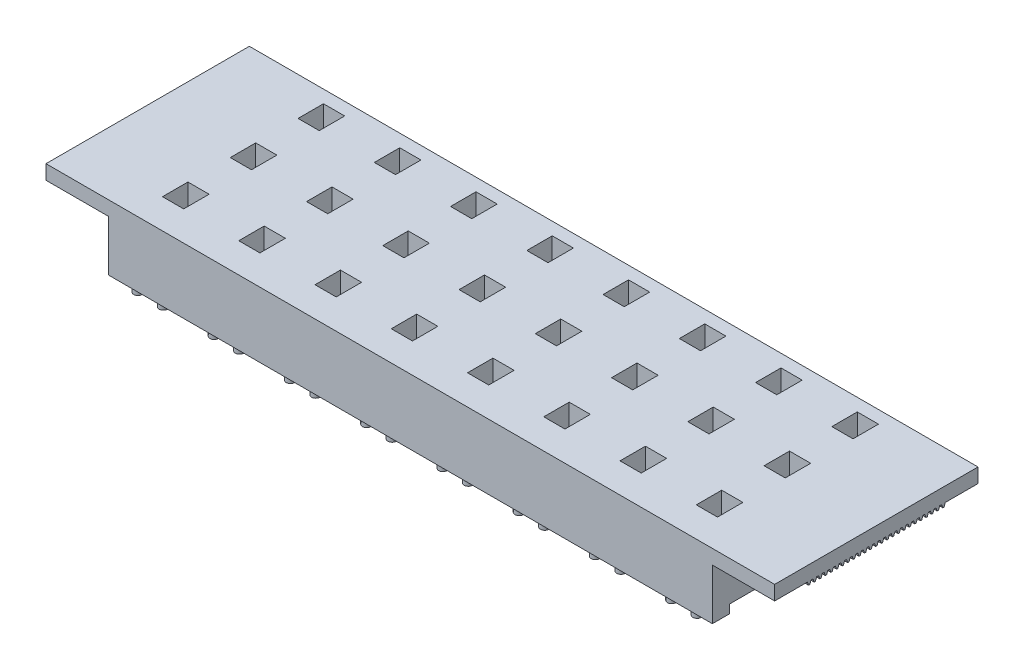
from build123d import *

# Parameters (mm, degrees)
SKETCH1_W                    = 86
SKETCH1_H                    = 24
BOSS_EXTRUDE1_DEPTH          = 6.7
SKETCH2_W                    = 7.35
SKETCH2_H                    = 5
CUT_EXTRUDE1_DEPTH           = 50.697987887
FIRST_RIDGE_DEPTH            = 78.65
RACK_LEFT_PATTERN_COUNT      = 13
RACK_LEFT_PATTERN_PITCH      = 0.66
RACK_LEFT_PATTERN_COL_COUNT  = 13
RACK_LEFT_PATTERN_COL_PITCH  = 0.66
MIRROR2_COPY_1_DEPTH         = 78.65
MIRROR2_COPY_2_DEPTH         = 78.65
MIRROR2_COPY_3_DEPTH         = 78.65
MIRROR2_COPY_4_DEPTH         = 78.65
MIRROR2_COPY_5_DEPTH         = 78.65
MIRROR2_COPY_6_DEPTH         = 78.65
MIRROR2_COPY_7_DEPTH         = 78.65
MIRROR2_COPY_8_DEPTH         = 78.65
MIRROR2_COPY_9_DEPTH         = 78.65
MIRROR2_COPY_10_DEPTH        = 78.65
MIRROR2_COPY_11_DEPTH        = 78.65
MIRROR2_COPY_12_DEPTH        = 78.65
MIRROR2_COPY_13_DEPTH        = 78.65
MIRROR2_COPY_14_DEPTH        = 78.65
MIRROR2_COPY_15_DEPTH        = 78.65
MIRROR2_COPY_16_DEPTH        = 78.65
MIRROR2_COPY_17_DEPTH        = 78.65
MIRROR2_COPY_18_DEPTH        = 78.65
MIRROR2_COPY_19_DEPTH        = 78.65
MIRROR2_COPY_20_DEPTH        = 78.65
MIRROR2_COPY_21_DEPTH        = 78.65
MIRROR2_COPY_22_DEPTH        = 78.65
MIRROR2_COPY_23_DEPTH        = 78.65
MIRROR2_COPY_24_DEPTH        = 78.65
SKETCH5_W                    = 2
SKETCH5_H                    = 1
BOSS_EXTRUDE2_DEPTH          = 71.3
SKETCH6_R                    = 0.5
BOSS_EXTRUDE3_DEPTH          = 1
LPATTERN1_COUNT              = 8
LPATTERN1_PITCH              = 9
LPATTERN2_COUNT              = 3
LPATTERN2_PITCH              = 8
LPATTERN2_COPY_1_SKETCH_R    = 0.5
LPATTERN2_COPY_1_DEPTH       = 1
LPATTERN2_COPY_2_SKETCH_R    = 0.5
LPATTERN2_COPY_2_DEPTH       = 1
LPATTERN2_COPY_3_SKETCH_R    = 0.5
LPATTERN2_COPY_3_DEPTH       = 1
LPATTERN2_COPY_4_SKETCH_R    = 0.5
LPATTERN2_COPY_4_DEPTH       = 1
LPATTERN2_COPY_5_SKETCH_R    = 0.5
LPATTERN2_COPY_5_DEPTH       = 1
LPATTERN2_COPY_6_SKETCH_R    = 0.5
LPATTERN2_COPY_6_DEPTH       = 1
LPATTERN2_COPY_7_SKETCH_R    = 0.5
LPATTERN2_COPY_7_DEPTH       = 1
LPATTERN2_COPY_8_SKETCH_R    = 0.5
LPATTERN2_COPY_8_DEPTH       = 1
LPATTERN2_COPY_9_SKETCH_R    = 0.5
LPATTERN2_COPY_9_DEPTH       = 1
LPATTERN2_COPY_10_SKETCH_R   = 0.5
LPATTERN2_COPY_10_DEPTH      = 1
LPATTERN2_COPY_11_SKETCH_R   = 0.5
LPATTERN2_COPY_11_DEPTH      = 1
LPATTERN2_COPY_12_SKETCH_R   = 0.5
LPATTERN2_COPY_12_DEPTH      = 1
LPATTERN2_COPY_13_SKETCH_R   = 0.5
LPATTERN2_COPY_13_DEPTH      = 1
LPATTERN2_COPY_14_SKETCH_R   = 0.5
LPATTERN2_COPY_14_DEPTH      = 1
SKETCH8_W                    = 4
SKETCH8_H                    = 4.5
SKETCH8_W_2                  = 2.5
SKETCH8_H_2                  = 3
BOSS_EXTRUDE4_DEPTH          = 2
SKETCH9_W                    = 2.5
SKETCH9_H                    = 3
CUT_EXTRUDE2_DEPTH           = 46.142995027
LPATTERN3_COUNT              = 4
LPATTERN3_PITCH              = 9
LPATTERN3_COL_COUNT          = 5
LPATTERN3_COL_PITCH          = 9
LPATTERN4_COUNT              = 3
LPATTERN4_PITCH              = 8
LPATTERN4_COPY_1_SKETCH_W    = 4
LPATTERN4_COPY_1_SKETCH_H    = 4.5
LPATTERN4_COPY_1_SKETCH_W_2  = 2.5
LPATTERN4_COPY_1_SKETCH_H_2  = 3
LPATTERN4_COPY_1_DEPTH       = 2
LPATTERN4_COPY_2_SKETCH_W    = 4
LPATTERN4_COPY_2_SKETCH_H    = 4.5
LPATTERN4_COPY_2_SKETCH_W_2  = 2.5
LPATTERN4_COPY_2_SKETCH_H_2  = 3
LPATTERN4_COPY_2_DEPTH       = 2
LPATTERN4_COPY_3_SKETCH_W    = 4
LPATTERN4_COPY_3_SKETCH_H    = 4.5
LPATTERN4_COPY_3_SKETCH_W_2  = 2.5
LPATTERN4_COPY_3_SKETCH_H_2  = 3
LPATTERN4_COPY_3_DEPTH       = 2
LPATTERN4_COPY_4_SKETCH_W    = 4
LPATTERN4_COPY_4_SKETCH_H    = 4.5
LPATTERN4_COPY_4_SKETCH_W_2  = 2.5
LPATTERN4_COPY_4_SKETCH_H_2  = 3
LPATTERN4_COPY_4_DEPTH       = 2
LPATTERN4_COPY_5_SKETCH_W    = 4
LPATTERN4_COPY_5_SKETCH_H    = 4.5
LPATTERN4_COPY_5_SKETCH_W_2  = 2.5
LPATTERN4_COPY_5_SKETCH_H_2  = 3
LPATTERN4_COPY_5_DEPTH       = 2
LPATTERN4_COPY_6_SKETCH_W    = 4
LPATTERN4_COPY_6_SKETCH_H    = 4.5
LPATTERN4_COPY_6_SKETCH_W_2  = 2.5
LPATTERN4_COPY_6_SKETCH_H_2  = 3
LPATTERN4_COPY_6_DEPTH       = 2
LPATTERN4_COPY_7_SKETCH_W    = 2.5
LPATTERN4_COPY_7_SKETCH_H    = 3
LPATTERN4_COPY_7_DEPTH       = 46.142995027
LPATTERN4_COPY_8_SKETCH_W    = 2.5
LPATTERN4_COPY_8_SKETCH_H    = 3
LPATTERN4_COPY_8_DEPTH       = 46.142995027
LPATTERN4_COPY_9_SKETCH_W    = 2.5
LPATTERN4_COPY_9_SKETCH_H    = 3
LPATTERN4_COPY_9_DEPTH       = 46.142995027
LPATTERN4_COPY_10_SKETCH_W   = 2.5
LPATTERN4_COPY_10_SKETCH_H   = 3
LPATTERN4_COPY_10_DEPTH      = 46.142995027
LPATTERN4_COPY_11_SKETCH_W   = 2.5
LPATTERN4_COPY_11_SKETCH_H   = 3
LPATTERN4_COPY_11_DEPTH      = 46.142995027
LPATTERN4_COPY_12_SKETCH_W   = 2.5
LPATTERN4_COPY_12_SKETCH_H   = 3
LPATTERN4_COPY_12_DEPTH      = 46.142995027
LPATTERN4_COPY_13_SKETCH_W   = 4
LPATTERN4_COPY_13_SKETCH_H   = 4.5
LPATTERN4_COPY_13_SKETCH_W_2 = 2.5
LPATTERN4_COPY_13_SKETCH_H_2 = 3
LPATTERN4_COPY_13_DEPTH      = 2
LPATTERN4_COPY_14_SKETCH_W   = 4
LPATTERN4_COPY_14_SKETCH_H   = 4.5
LPATTERN4_COPY_14_SKETCH_W_2 = 2.5
LPATTERN4_COPY_14_SKETCH_H_2 = 3
LPATTERN4_COPY_14_DEPTH      = 2
LPATTERN4_COPY_15_SKETCH_W   = 4
LPATTERN4_COPY_15_SKETCH_H   = 4.5
LPATTERN4_COPY_15_SKETCH_W_2 = 2.5
LPATTERN4_COPY_15_SKETCH_H_2 = 3
LPATTERN4_COPY_15_DEPTH      = 2
LPATTERN4_COPY_16_SKETCH_W   = 4
LPATTERN4_COPY_16_SKETCH_H   = 4.5
LPATTERN4_COPY_16_SKETCH_W_2 = 2.5
LPATTERN4_COPY_16_SKETCH_H_2 = 3
LPATTERN4_COPY_16_DEPTH      = 2
LPATTERN4_COPY_17_SKETCH_W   = 4
LPATTERN4_COPY_17_SKETCH_H   = 4.5
LPATTERN4_COPY_17_SKETCH_W_2 = 2.5
LPATTERN4_COPY_17_SKETCH_H_2 = 3
LPATTERN4_COPY_17_DEPTH      = 2
LPATTERN4_COPY_18_SKETCH_W   = 4
LPATTERN4_COPY_18_SKETCH_H   = 4.5
LPATTERN4_COPY_18_SKETCH_W_2 = 2.5
LPATTERN4_COPY_18_SKETCH_H_2 = 3
LPATTERN4_COPY_18_DEPTH      = 2
LPATTERN4_COPY_19_SKETCH_W   = 4
LPATTERN4_COPY_19_SKETCH_H   = 4.5
LPATTERN4_COPY_19_SKETCH_W_2 = 2.5
LPATTERN4_COPY_19_SKETCH_H_2 = 3
LPATTERN4_COPY_19_DEPTH      = 2
LPATTERN4_COPY_20_SKETCH_W   = 4
LPATTERN4_COPY_20_SKETCH_H   = 4.5
LPATTERN4_COPY_20_SKETCH_W_2 = 2.5
LPATTERN4_COPY_20_SKETCH_H_2 = 3
LPATTERN4_COPY_20_DEPTH      = 2
LPATTERN4_COPY_21_SKETCH_W   = 2.5
LPATTERN4_COPY_21_SKETCH_H   = 3
LPATTERN4_COPY_21_DEPTH      = 46.142995027
LPATTERN4_COPY_22_SKETCH_W   = 2.5
LPATTERN4_COPY_22_SKETCH_H   = 3
LPATTERN4_COPY_22_DEPTH      = 46.142995027
LPATTERN4_COPY_23_SKETCH_W   = 2.5
LPATTERN4_COPY_23_SKETCH_H   = 3
LPATTERN4_COPY_23_DEPTH      = 46.142995027
LPATTERN4_COPY_24_SKETCH_W   = 2.5
LPATTERN4_COPY_24_SKETCH_H   = 3
LPATTERN4_COPY_24_DEPTH      = 46.142995027
LPATTERN4_COPY_25_SKETCH_W   = 2.5
LPATTERN4_COPY_25_SKETCH_H   = 3
LPATTERN4_COPY_25_DEPTH      = 46.142995027
LPATTERN4_COPY_26_SKETCH_W   = 2.5
LPATTERN4_COPY_26_SKETCH_H   = 3
LPATTERN4_COPY_26_DEPTH      = 46.142995027
LPATTERN4_COPY_27_SKETCH_W   = 2.5
LPATTERN4_COPY_27_SKETCH_H   = 3
LPATTERN4_COPY_27_DEPTH      = 46.142995027
LPATTERN4_COPY_28_SKETCH_W   = 2.5
LPATTERN4_COPY_28_SKETCH_H   = 3
LPATTERN4_COPY_28_DEPTH      = 46.142995027
LPATTERN4_COPY_29_SKETCH_W   = 2.5
LPATTERN4_COPY_29_SKETCH_H   = 3
LPATTERN4_COPY_29_DEPTH      = 46.142995027
LPATTERN4_COPY_30_SKETCH_W   = 2.5
LPATTERN4_COPY_30_SKETCH_H   = 3
LPATTERN4_COPY_30_DEPTH      = 46.142995027


with BuildPart() as part:
    # Sketch1 → Boss-Extrude1 (new body)
    with BuildSketch(Plane(origin=(0, 0, 0), x_dir=(1, 0, 0), z_dir=(0, 1, 0))):
        Rectangle(SKETCH1_W, SKETCH1_H)
    extrude(amount=BOSS_EXTRUDE1_DEPTH)

    # Sketch2 → Cut-Extrude1 (cut, through all)
    with BuildSketch(Plane.XY.offset(12)):
        with Locations((39.325, 2.5)):
            Rectangle(SKETCH2_W, SKETCH2_H)
    cut_extrude1 = extrude(amount=-CUT_EXTRUDE1_DEPTH, mode=Mode.SUBTRACT)

    # Mirror1: Cut-Extrude1 across plane
    add(cut_extrude1.mirror(Plane(origin=(0, 0, 0), x_dir=(0, 0, 1), z_dir=(1, 0, 0))), mode=Mode.SUBTRACT)

    # Sketch4 → First Ridge (add)
    with BuildSketch(Plane(origin=(43, 0, 0), x_dir=(0, 0, -1), z_dir=(1, 0, 0))):
        Polygon((0.220588094, 5), (-0.220588094, 5), (-0.075, 4.6), (0.075, 4.6), align=None)
    first_ridge = extrude(amount=-FIRST_RIDGE_DEPTH)

    # Rack Left Pattern: First Ridge ×13
    with Locations(*[(0, 0, i * RACK_LEFT_PATTERN_PITCH) for i in range(1, RACK_LEFT_PATTERN_COUNT)]):
        add(first_ridge)

    # Rack Left Pattern col: First Ridge ×13
    with Locations(*[(0, 0, -i * RACK_LEFT_PATTERN_COL_PITCH) for i in range(1, RACK_LEFT_PATTERN_COL_COUNT)]):
        add(first_ridge)

    # Mirror2: First Ridge across plane
    add(first_ridge.mirror(Plane(origin=(0, 0, 0), x_dir=(0, 0, 1), z_dir=(1, 0, 0))))

    # Mirror2 copy 1 sketch → Mirror2 copy 1 (add)
    with BuildSketch(Plane(origin=(-43, 0, 0.66), x_dir=(0, 0, -1), z_dir=(-1, 0, 0))):
        Polygon((0.220588094, -5), (-0.220588094, -5), (-0.075, -4.6), (0.075, -4.6), align=None)
    extrude(amount=-MIRROR2_COPY_1_DEPTH)

    # Mirror2 copy 2 sketch → Mirror2 copy 2 (add)
    with BuildSketch(Plane(origin=(-43, 0, 1.32), x_dir=(0, 0, -1), z_dir=(-1, 0, 0))):
        Polygon((0.220588094, -5), (-0.220588094, -5), (-0.075, -4.6), (0.075, -4.6), align=None)
    extrude(amount=-MIRROR2_COPY_2_DEPTH)

    # Mirror2 copy 3 sketch → Mirror2 copy 3 (add)
    with BuildSketch(Plane(origin=(-43, 0, 1.98), x_dir=(0, 0, -1), z_dir=(-1, 0, 0))):
        Polygon((0.220588094, -5), (-0.220588094, -5), (-0.075, -4.6), (0.075, -4.6), align=None)
    extrude(amount=-MIRROR2_COPY_3_DEPTH)

    # Mirror2 copy 4 sketch → Mirror2 copy 4 (add)
    with BuildSketch(Plane(origin=(-43, 0, 2.64), x_dir=(0, 0, -1), z_dir=(-1, 0, 0))):
        Polygon((0.220588094, -5), (-0.220588094, -5), (-0.075, -4.6), (0.075, -4.6), align=None)
    extrude(amount=-MIRROR2_COPY_4_DEPTH)

    # Mirror2 copy 5 sketch → Mirror2 copy 5 (add)
    with BuildSketch(Plane(origin=(-43, 0, 3.3), x_dir=(0, 0, -1), z_dir=(-1, 0, 0))):
        Polygon((0.220588094, -5), (-0.220588094, -5), (-0.075, -4.6), (0.075, -4.6), align=None)
    extrude(amount=-MIRROR2_COPY_5_DEPTH)

    # Mirror2 copy 6 sketch → Mirror2 copy 6 (add)
    with BuildSketch(Plane(origin=(-43, 0, 3.96), x_dir=(0, 0, -1), z_dir=(-1, 0, 0))):
        Polygon((0.220588094, -5), (-0.220588094, -5), (-0.075, -4.6), (0.075, -4.6), align=None)
    extrude(amount=-MIRROR2_COPY_6_DEPTH)

    # Mirror2 copy 7 sketch → Mirror2 copy 7 (add)
    with BuildSketch(Plane(origin=(-43, 0, 4.62), x_dir=(0, 0, -1), z_dir=(-1, 0, 0))):
        Polygon((0.220588094, -5), (-0.220588094, -5), (-0.075, -4.6), (0.075, -4.6), align=None)
    extrude(amount=-MIRROR2_COPY_7_DEPTH)

    # Mirror2 copy 8 sketch → Mirror2 copy 8 (add)
    with BuildSketch(Plane(origin=(-43, 0, 5.28), x_dir=(0, 0, -1), z_dir=(-1, 0, 0))):
        Polygon((0.220588094, -5), (-0.220588094, -5), (-0.075, -4.6), (0.075, -4.6), align=None)
    extrude(amount=-MIRROR2_COPY_8_DEPTH)

    # Mirror2 copy 9 sketch → Mirror2 copy 9 (add)
    with BuildSketch(Plane(origin=(-43, 0, 5.94), x_dir=(0, 0, -1), z_dir=(-1, 0, 0))):
        Polygon((0.220588094, -5), (-0.220588094, -5), (-0.075, -4.6), (0.075, -4.6), align=None)
    extrude(amount=-MIRROR2_COPY_9_DEPTH)

    # Mirror2 copy 10 sketch → Mirror2 copy 10 (add)
    with BuildSketch(Plane(origin=(-43, 0, 6.6), x_dir=(0, 0, -1), z_dir=(-1, 0, 0))):
        Polygon((0.220588094, -5), (-0.220588094, -5), (-0.075, -4.6), (0.075, -4.6), align=None)
    extrude(amount=-MIRROR2_COPY_10_DEPTH)

    # Mirror2 copy 11 sketch → Mirror2 copy 11 (add)
    with BuildSketch(Plane(origin=(-43, 0, 7.26), x_dir=(0, 0, -1), z_dir=(-1, 0, 0))):
        Polygon((0.220588094, -5), (-0.220588094, -5), (-0.075, -4.6), (0.075, -4.6), align=None)
    extrude(amount=-MIRROR2_COPY_11_DEPTH)

    # Mirror2 copy 12 sketch → Mirror2 copy 12 (add)
    with BuildSketch(Plane(origin=(-43, 0, 7.92), x_dir=(0, 0, -1), z_dir=(-1, 0, 0))):
        Polygon((0.220588094, -5), (-0.220588094, -5), (-0.075, -4.6), (0.075, -4.6), align=None)
    extrude(amount=-MIRROR2_COPY_12_DEPTH)

    # Mirror2 copy 13 sketch → Mirror2 copy 13 (add)
    with BuildSketch(Plane(origin=(-43, 0, -0.66), x_dir=(0, 0, -1), z_dir=(-1, 0, 0))):
        Polygon((0.220588094, -5), (-0.220588094, -5), (-0.075, -4.6), (0.075, -4.6), align=None)
    extrude(amount=-MIRROR2_COPY_13_DEPTH)

    # Mirror2 copy 14 sketch → Mirror2 copy 14 (add)
    with BuildSketch(Plane(origin=(-43, 0, -1.32), x_dir=(0, 0, -1), z_dir=(-1, 0, 0))):
        Polygon((0.220588094, -5), (-0.220588094, -5), (-0.075, -4.6), (0.075, -4.6), align=None)
    extrude(amount=-MIRROR2_COPY_14_DEPTH)

    # Mirror2 copy 15 sketch → Mirror2 copy 15 (add)
    with BuildSketch(Plane(origin=(-43, 0, -1.98), x_dir=(0, 0, -1), z_dir=(-1, 0, 0))):
        Polygon((0.220588094, -5), (-0.220588094, -5), (-0.075, -4.6), (0.075, -4.6), align=None)
    extrude(amount=-MIRROR2_COPY_15_DEPTH)

    # Mirror2 copy 16 sketch → Mirror2 copy 16 (add)
    with BuildSketch(Plane(origin=(-43, 0, -2.64), x_dir=(0, 0, -1), z_dir=(-1, 0, 0))):
        Polygon((0.220588094, -5), (-0.220588094, -5), (-0.075, -4.6), (0.075, -4.6), align=None)
    extrude(amount=-MIRROR2_COPY_16_DEPTH)

    # Mirror2 copy 17 sketch → Mirror2 copy 17 (add)
    with BuildSketch(Plane(origin=(-43, 0, -3.3), x_dir=(0, 0, -1), z_dir=(-1, 0, 0))):
        Polygon((0.220588094, -5), (-0.220588094, -5), (-0.075, -4.6), (0.075, -4.6), align=None)
    extrude(amount=-MIRROR2_COPY_17_DEPTH)

    # Mirror2 copy 18 sketch → Mirror2 copy 18 (add)
    with BuildSketch(Plane(origin=(-43, 0, -3.96), x_dir=(0, 0, -1), z_dir=(-1, 0, 0))):
        Polygon((0.220588094, -5), (-0.220588094, -5), (-0.075, -4.6), (0.075, -4.6), align=None)
    extrude(amount=-MIRROR2_COPY_18_DEPTH)

    # Mirror2 copy 19 sketch → Mirror2 copy 19 (add)
    with BuildSketch(Plane(origin=(-43, 0, -4.62), x_dir=(0, 0, -1), z_dir=(-1, 0, 0))):
        Polygon((0.220588094, -5), (-0.220588094, -5), (-0.075, -4.6), (0.075, -4.6), align=None)
    extrude(amount=-MIRROR2_COPY_19_DEPTH)

    # Mirror2 copy 20 sketch → Mirror2 copy 20 (add)
    with BuildSketch(Plane(origin=(-43, 0, -5.28), x_dir=(0, 0, -1), z_dir=(-1, 0, 0))):
        Polygon((0.220588094, -5), (-0.220588094, -5), (-0.075, -4.6), (0.075, -4.6), align=None)
    extrude(amount=-MIRROR2_COPY_20_DEPTH)

    # Mirror2 copy 21 sketch → Mirror2 copy 21 (add)
    with BuildSketch(Plane(origin=(-43, 0, -5.94), x_dir=(0, 0, -1), z_dir=(-1, 0, 0))):
        Polygon((0.220588094, -5), (-0.220588094, -5), (-0.075, -4.6), (0.075, -4.6), align=None)
    extrude(amount=-MIRROR2_COPY_21_DEPTH)

    # Mirror2 copy 22 sketch → Mirror2 copy 22 (add)
    with BuildSketch(Plane(origin=(-43, 0, -6.6), x_dir=(0, 0, -1), z_dir=(-1, 0, 0))):
        Polygon((0.220588094, -5), (-0.220588094, -5), (-0.075, -4.6), (0.075, -4.6), align=None)
    extrude(amount=-MIRROR2_COPY_22_DEPTH)

    # Mirror2 copy 23 sketch → Mirror2 copy 23 (add)
    with BuildSketch(Plane(origin=(-43, 0, -7.26), x_dir=(0, 0, -1), z_dir=(-1, 0, 0))):
        Polygon((0.220588094, -5), (-0.220588094, -5), (-0.075, -4.6), (0.075, -4.6), align=None)
    extrude(amount=-MIRROR2_COPY_23_DEPTH)

    # Mirror2 copy 24 sketch → Mirror2 copy 24 (add)
    with BuildSketch(Plane(origin=(-43, 0, -7.92), x_dir=(0, 0, -1), z_dir=(-1, 0, 0))):
        Polygon((0.220588094, -5), (-0.220588094, -5), (-0.075, -4.6), (0.075, -4.6), align=None)
    extrude(amount=-MIRROR2_COPY_24_DEPTH)

    # Sketch5 → Boss-Extrude2 (add)
    with BuildSketch(Plane.ZY.offset(35.65)):
        with Locations((-5, -0.5)):
            Rectangle(SKETCH5_W, SKETCH5_H)
        with Locations((3, -0.5)):
            Rectangle(SKETCH5_W, SKETCH5_H)
        with Locations((11, -0.5)):
            Rectangle(SKETCH5_W, SKETCH5_H)
    extrude(amount=-BOSS_EXTRUDE2_DEPTH)

    # Sketch6 → Boss-Extrude3 (add)
    with BuildSketch(Plane.XZ.offset(1)):
        with Locations(Location((-33.15, -5, 0), (0, 0, 270))):
            Circle(SKETCH6_R)
        with Locations(Location((-30.15, -5, 0), (0, 0, 270))):
            Circle(SKETCH6_R)
    boss_extrude3 = extrude(amount=BOSS_EXTRUDE3_DEPTH)

    # LPattern1: Boss-Extrude3 ×8
    with Locations(*[(i * LPATTERN1_PITCH, 0, 0) for i in range(1, LPATTERN1_COUNT)]):
        add(boss_extrude3)

    # LPattern2: Boss-Extrude3 ×3
    with Locations(*[(0, 0, i * LPATTERN2_PITCH) for i in range(1, LPATTERN2_COUNT)]):
        add(boss_extrude3)

    # LPattern2 copy 1 sketch → LPattern2 copy 1 (add)
    with BuildSketch(Plane(origin=(9, -1, 8), x_dir=(1, 0, 0), z_dir=(0, -1, 0))):
        with Locations(Location((-33.15, -5, 0), (0, 0, 270))):
            Circle(LPATTERN2_COPY_1_SKETCH_R)
        with Locations(Location((-30.15, -5, 0), (0, 0, 270))):
            Circle(LPATTERN2_COPY_1_SKETCH_R)
    extrude(amount=LPATTERN2_COPY_1_DEPTH)

    # LPattern2 copy 2 sketch → LPattern2 copy 2 (add)
    with BuildSketch(Plane(origin=(9, -1, 16), x_dir=(1, 0, 0), z_dir=(0, -1, 0))):
        with Locations(Location((-33.15, -5, 0), (0, 0, 270))):
            Circle(LPATTERN2_COPY_2_SKETCH_R)
        with Locations(Location((-30.15, -5, 0), (0, 0, 270))):
            Circle(LPATTERN2_COPY_2_SKETCH_R)
    extrude(amount=LPATTERN2_COPY_2_DEPTH)

    # LPattern2 copy 3 sketch → LPattern2 copy 3 (add)
    with BuildSketch(Plane(origin=(18, -1, 8), x_dir=(1, 0, 0), z_dir=(0, -1, 0))):
        with Locations(Location((-33.15, -5, 0), (0, 0, 270))):
            Circle(LPATTERN2_COPY_3_SKETCH_R)
        with Locations(Location((-30.15, -5, 0), (0, 0, 270))):
            Circle(LPATTERN2_COPY_3_SKETCH_R)
    extrude(amount=LPATTERN2_COPY_3_DEPTH)

    # LPattern2 copy 4 sketch → LPattern2 copy 4 (add)
    with BuildSketch(Plane(origin=(18, -1, 16), x_dir=(1, 0, 0), z_dir=(0, -1, 0))):
        with Locations(Location((-33.15, -5, 0), (0, 0, 270))):
            Circle(LPATTERN2_COPY_4_SKETCH_R)
        with Locations(Location((-30.15, -5, 0), (0, 0, 270))):
            Circle(LPATTERN2_COPY_4_SKETCH_R)
    extrude(amount=LPATTERN2_COPY_4_DEPTH)

    # LPattern2 copy 5 sketch → LPattern2 copy 5 (add)
    with BuildSketch(Plane(origin=(27, -1, 8), x_dir=(1, 0, 0), z_dir=(0, -1, 0))):
        with Locations(Location((-33.15, -5, 0), (0, 0, 270))):
            Circle(LPATTERN2_COPY_5_SKETCH_R)
        with Locations(Location((-30.15, -5, 0), (0, 0, 270))):
            Circle(LPATTERN2_COPY_5_SKETCH_R)
    extrude(amount=LPATTERN2_COPY_5_DEPTH)

    # LPattern2 copy 6 sketch → LPattern2 copy 6 (add)
    with BuildSketch(Plane(origin=(27, -1, 16), x_dir=(1, 0, 0), z_dir=(0, -1, 0))):
        with Locations(Location((-33.15, -5, 0), (0, 0, 270))):
            Circle(LPATTERN2_COPY_6_SKETCH_R)
        with Locations(Location((-30.15, -5, 0), (0, 0, 270))):
            Circle(LPATTERN2_COPY_6_SKETCH_R)
    extrude(amount=LPATTERN2_COPY_6_DEPTH)

    # LPattern2 copy 7 sketch → LPattern2 copy 7 (add)
    with BuildSketch(Plane(origin=(36, -1, 8), x_dir=(1, 0, 0), z_dir=(0, -1, 0))):
        with Locations(Location((-33.15, -5, 0), (0, 0, 270))):
            Circle(LPATTERN2_COPY_7_SKETCH_R)
        with Locations(Location((-30.15, -5, 0), (0, 0, 270))):
            Circle(LPATTERN2_COPY_7_SKETCH_R)
    extrude(amount=LPATTERN2_COPY_7_DEPTH)

    # LPattern2 copy 8 sketch → LPattern2 copy 8 (add)
    with BuildSketch(Plane(origin=(36, -1, 16), x_dir=(1, 0, 0), z_dir=(0, -1, 0))):
        with Locations(Location((-33.15, -5, 0), (0, 0, 270))):
            Circle(LPATTERN2_COPY_8_SKETCH_R)
        with Locations(Location((-30.15, -5, 0), (0, 0, 270))):
            Circle(LPATTERN2_COPY_8_SKETCH_R)
    extrude(amount=LPATTERN2_COPY_8_DEPTH)

    # LPattern2 copy 9 sketch → LPattern2 copy 9 (add)
    with BuildSketch(Plane(origin=(45, -1, 8), x_dir=(1, 0, 0), z_dir=(0, -1, 0))):
        with Locations(Location((-33.15, -5, 0), (0, 0, 270))):
            Circle(LPATTERN2_COPY_9_SKETCH_R)
        with Locations(Location((-30.15, -5, 0), (0, 0, 270))):
            Circle(LPATTERN2_COPY_9_SKETCH_R)
    extrude(amount=LPATTERN2_COPY_9_DEPTH)

    # LPattern2 copy 10 sketch → LPattern2 copy 10 (add)
    with BuildSketch(Plane(origin=(45, -1, 16), x_dir=(1, 0, 0), z_dir=(0, -1, 0))):
        with Locations(Location((-33.15, -5, 0), (0, 0, 270))):
            Circle(LPATTERN2_COPY_10_SKETCH_R)
        with Locations(Location((-30.15, -5, 0), (0, 0, 270))):
            Circle(LPATTERN2_COPY_10_SKETCH_R)
    extrude(amount=LPATTERN2_COPY_10_DEPTH)

    # LPattern2 copy 11 sketch → LPattern2 copy 11 (add)
    with BuildSketch(Plane(origin=(54, -1, 8), x_dir=(1, 0, 0), z_dir=(0, -1, 0))):
        with Locations(Location((-33.15, -5, 0), (0, 0, 270))):
            Circle(LPATTERN2_COPY_11_SKETCH_R)
        with Locations(Location((-30.15, -5, 0), (0, 0, 270))):
            Circle(LPATTERN2_COPY_11_SKETCH_R)
    extrude(amount=LPATTERN2_COPY_11_DEPTH)

    # LPattern2 copy 12 sketch → LPattern2 copy 12 (add)
    with BuildSketch(Plane(origin=(54, -1, 16), x_dir=(1, 0, 0), z_dir=(0, -1, 0))):
        with Locations(Location((-33.15, -5, 0), (0, 0, 270))):
            Circle(LPATTERN2_COPY_12_SKETCH_R)
        with Locations(Location((-30.15, -5, 0), (0, 0, 270))):
            Circle(LPATTERN2_COPY_12_SKETCH_R)
    extrude(amount=LPATTERN2_COPY_12_DEPTH)

    # LPattern2 copy 13 sketch → LPattern2 copy 13 (add)
    with BuildSketch(Plane(origin=(63, -1, 8), x_dir=(1, 0, 0), z_dir=(0, -1, 0))):
        with Locations(Location((-33.15, -5, 0), (0, 0, 270))):
            Circle(LPATTERN2_COPY_13_SKETCH_R)
        with Locations(Location((-30.15, -5, 0), (0, 0, 270))):
            Circle(LPATTERN2_COPY_13_SKETCH_R)
    extrude(amount=LPATTERN2_COPY_13_DEPTH)

    # LPattern2 copy 14 sketch → LPattern2 copy 14 (add)
    with BuildSketch(Plane(origin=(63, -1, 16), x_dir=(1, 0, 0), z_dir=(0, -1, 0))):
        with Locations(Location((-33.15, -5, 0), (0, 0, 270))):
            Circle(LPATTERN2_COPY_14_SKETCH_R)
        with Locations(Location((-30.15, -5, 0), (0, 0, 270))):
            Circle(LPATTERN2_COPY_14_SKETCH_R)
    extrude(amount=LPATTERN2_COPY_14_DEPTH)

    # Sketch8 → Boss-Extrude4 (add)
    with BuildSketch(Plane.XZ):
        with Locations((-4.5, 7)):
            Rectangle(SKETCH8_W, SKETCH8_H)
        with Locations((-4.5, 7)):
            Rectangle(SKETCH8_W_2, SKETCH8_H_2, mode=Mode.SUBTRACT)
    boss_extrude4 = extrude(amount=BOSS_EXTRUDE4_DEPTH)

    # Sketch9 → Cut-Extrude2 (cut, through all)
    with BuildSketch(Plane.XZ):
        with Locations((-4.5, 7)):
            Rectangle(SKETCH9_W, SKETCH9_H)
    cut_extrude2 = extrude(amount=-CUT_EXTRUDE2_DEPTH, mode=Mode.SUBTRACT)

    # LPattern3: Boss-Extrude4, Cut-Extrude2 ×4
    with Locations(*[(-i * LPATTERN3_PITCH, 0, 0) for i in range(1, LPATTERN3_COUNT)]):
        add(boss_extrude4)
        add(cut_extrude2, mode=Mode.SUBTRACT)

    # LPattern3 col: Boss-Extrude4, Cut-Extrude2 ×5
    with Locations(*[(i * LPATTERN3_COL_PITCH, 0, 0) for i in range(1, LPATTERN3_COL_COUNT)]):
        add(boss_extrude4)
        add(cut_extrude2, mode=Mode.SUBTRACT)

    # LPattern4: Boss-Extrude4 ×3
    with Locations(*[(0, 0, -i * LPATTERN4_PITCH) for i in range(1, LPATTERN4_COUNT)]):
        add(boss_extrude4)

    # LPattern4 copy 1 sketch → LPattern4 copy 1 (add)
    with BuildSketch(Plane(origin=(-9, 0, -8), x_dir=(1, 0, 0), z_dir=(0, -1, 0))):
        with Locations((-4.5, 7)):
            Rectangle(LPATTERN4_COPY_1_SKETCH_W, LPATTERN4_COPY_1_SKETCH_H)
        with Locations((-4.5, 7)):
            Rectangle(LPATTERN4_COPY_1_SKETCH_W_2, LPATTERN4_COPY_1_SKETCH_H_2, mode=Mode.SUBTRACT)
    extrude(amount=LPATTERN4_COPY_1_DEPTH)

    # LPattern4 copy 2 sketch → LPattern4 copy 2 (add)
    with BuildSketch(Plane(origin=(-9, 0, -16), x_dir=(1, 0, 0), z_dir=(0, -1, 0))):
        with Locations((-4.5, 7)):
            Rectangle(LPATTERN4_COPY_2_SKETCH_W, LPATTERN4_COPY_2_SKETCH_H)
        with Locations((-4.5, 7)):
            Rectangle(LPATTERN4_COPY_2_SKETCH_W_2, LPATTERN4_COPY_2_SKETCH_H_2, mode=Mode.SUBTRACT)
    extrude(amount=LPATTERN4_COPY_2_DEPTH)

    # LPattern4 copy 3 sketch → LPattern4 copy 3 (add)
    with BuildSketch(Plane(origin=(-18, 0, -8), x_dir=(1, 0, 0), z_dir=(0, -1, 0))):
        with Locations((-4.5, 7)):
            Rectangle(LPATTERN4_COPY_3_SKETCH_W, LPATTERN4_COPY_3_SKETCH_H)
        with Locations((-4.5, 7)):
            Rectangle(LPATTERN4_COPY_3_SKETCH_W_2, LPATTERN4_COPY_3_SKETCH_H_2, mode=Mode.SUBTRACT)
    extrude(amount=LPATTERN4_COPY_3_DEPTH)

    # LPattern4 copy 4 sketch → LPattern4 copy 4 (add)
    with BuildSketch(Plane(origin=(-18, 0, -16), x_dir=(1, 0, 0), z_dir=(0, -1, 0))):
        with Locations((-4.5, 7)):
            Rectangle(LPATTERN4_COPY_4_SKETCH_W, LPATTERN4_COPY_4_SKETCH_H)
        with Locations((-4.5, 7)):
            Rectangle(LPATTERN4_COPY_4_SKETCH_W_2, LPATTERN4_COPY_4_SKETCH_H_2, mode=Mode.SUBTRACT)
    extrude(amount=LPATTERN4_COPY_4_DEPTH)

    # LPattern4 copy 5 sketch → LPattern4 copy 5 (add)
    with BuildSketch(Plane(origin=(-27, 0, -8), x_dir=(1, 0, 0), z_dir=(0, -1, 0))):
        with Locations((-4.5, 7)):
            Rectangle(LPATTERN4_COPY_5_SKETCH_W, LPATTERN4_COPY_5_SKETCH_H)
        with Locations((-4.5, 7)):
            Rectangle(LPATTERN4_COPY_5_SKETCH_W_2, LPATTERN4_COPY_5_SKETCH_H_2, mode=Mode.SUBTRACT)
    extrude(amount=LPATTERN4_COPY_5_DEPTH)

    # LPattern4 copy 6 sketch → LPattern4 copy 6 (add)
    with BuildSketch(Plane(origin=(-27, 0, -16), x_dir=(1, 0, 0), z_dir=(0, -1, 0))):
        with Locations((-4.5, 7)):
            Rectangle(LPATTERN4_COPY_6_SKETCH_W, LPATTERN4_COPY_6_SKETCH_H)
        with Locations((-4.5, 7)):
            Rectangle(LPATTERN4_COPY_6_SKETCH_W_2, LPATTERN4_COPY_6_SKETCH_H_2, mode=Mode.SUBTRACT)
    extrude(amount=LPATTERN4_COPY_6_DEPTH)

    # LPattern4 copy 7 sketch → LPattern4 copy 7 (cut, through all)
    with BuildSketch(Plane(origin=(-9, 0, -8), x_dir=(1, 0, 0), z_dir=(0, -1, 0))):
        with Locations((-4.5, 7)):
            Rectangle(LPATTERN4_COPY_7_SKETCH_W, LPATTERN4_COPY_7_SKETCH_H)
    extrude(amount=-LPATTERN4_COPY_7_DEPTH, mode=Mode.SUBTRACT)

    # LPattern4 copy 8 sketch → LPattern4 copy 8 (cut, through all)
    with BuildSketch(Plane(origin=(-9, 0, -16), x_dir=(1, 0, 0), z_dir=(0, -1, 0))):
        with Locations((-4.5, 7)):
            Rectangle(LPATTERN4_COPY_8_SKETCH_W, LPATTERN4_COPY_8_SKETCH_H)
    extrude(amount=-LPATTERN4_COPY_8_DEPTH, mode=Mode.SUBTRACT)

    # LPattern4 copy 9 sketch → LPattern4 copy 9 (cut, through all)
    with BuildSketch(Plane(origin=(-18, 0, -8), x_dir=(1, 0, 0), z_dir=(0, -1, 0))):
        with Locations((-4.5, 7)):
            Rectangle(LPATTERN4_COPY_9_SKETCH_W, LPATTERN4_COPY_9_SKETCH_H)
    extrude(amount=-LPATTERN4_COPY_9_DEPTH, mode=Mode.SUBTRACT)

    # LPattern4 copy 10 sketch → LPattern4 copy 10 (cut, through all)
    with BuildSketch(Plane(origin=(-18, 0, -16), x_dir=(1, 0, 0), z_dir=(0, -1, 0))):
        with Locations((-4.5, 7)):
            Rectangle(LPATTERN4_COPY_10_SKETCH_W, LPATTERN4_COPY_10_SKETCH_H)
    extrude(amount=-LPATTERN4_COPY_10_DEPTH, mode=Mode.SUBTRACT)

    # LPattern4 copy 11 sketch → LPattern4 copy 11 (cut, through all)
    with BuildSketch(Plane(origin=(-27, 0, -8), x_dir=(1, 0, 0), z_dir=(0, -1, 0))):
        with Locations((-4.5, 7)):
            Rectangle(LPATTERN4_COPY_11_SKETCH_W, LPATTERN4_COPY_11_SKETCH_H)
    extrude(amount=-LPATTERN4_COPY_11_DEPTH, mode=Mode.SUBTRACT)

    # LPattern4 copy 12 sketch → LPattern4 copy 12 (cut, through all)
    with BuildSketch(Plane(origin=(-27, 0, -16), x_dir=(1, 0, 0), z_dir=(0, -1, 0))):
        with Locations((-4.5, 7)):
            Rectangle(LPATTERN4_COPY_12_SKETCH_W, LPATTERN4_COPY_12_SKETCH_H)
    extrude(amount=-LPATTERN4_COPY_12_DEPTH, mode=Mode.SUBTRACT)

    # LPattern4 copy 13 sketch → LPattern4 copy 13 (add)
    with BuildSketch(Plane(origin=(9, 0, -8), x_dir=(1, 0, 0), z_dir=(0, -1, 0))):
        with Locations((-4.5, 7)):
            Rectangle(LPATTERN4_COPY_13_SKETCH_W, LPATTERN4_COPY_13_SKETCH_H)
        with Locations((-4.5, 7)):
            Rectangle(LPATTERN4_COPY_13_SKETCH_W_2, LPATTERN4_COPY_13_SKETCH_H_2, mode=Mode.SUBTRACT)
    extrude(amount=LPATTERN4_COPY_13_DEPTH)

    # LPattern4 copy 14 sketch → LPattern4 copy 14 (add)
    with BuildSketch(Plane(origin=(9, 0, -16), x_dir=(1, 0, 0), z_dir=(0, -1, 0))):
        with Locations((-4.5, 7)):
            Rectangle(LPATTERN4_COPY_14_SKETCH_W, LPATTERN4_COPY_14_SKETCH_H)
        with Locations((-4.5, 7)):
            Rectangle(LPATTERN4_COPY_14_SKETCH_W_2, LPATTERN4_COPY_14_SKETCH_H_2, mode=Mode.SUBTRACT)
    extrude(amount=LPATTERN4_COPY_14_DEPTH)

    # LPattern4 copy 15 sketch → LPattern4 copy 15 (add)
    with BuildSketch(Plane(origin=(18, 0, -8), x_dir=(1, 0, 0), z_dir=(0, -1, 0))):
        with Locations((-4.5, 7)):
            Rectangle(LPATTERN4_COPY_15_SKETCH_W, LPATTERN4_COPY_15_SKETCH_H)
        with Locations((-4.5, 7)):
            Rectangle(LPATTERN4_COPY_15_SKETCH_W_2, LPATTERN4_COPY_15_SKETCH_H_2, mode=Mode.SUBTRACT)
    extrude(amount=LPATTERN4_COPY_15_DEPTH)

    # LPattern4 copy 16 sketch → LPattern4 copy 16 (add)
    with BuildSketch(Plane(origin=(18, 0, -16), x_dir=(1, 0, 0), z_dir=(0, -1, 0))):
        with Locations((-4.5, 7)):
            Rectangle(LPATTERN4_COPY_16_SKETCH_W, LPATTERN4_COPY_16_SKETCH_H)
        with Locations((-4.5, 7)):
            Rectangle(LPATTERN4_COPY_16_SKETCH_W_2, LPATTERN4_COPY_16_SKETCH_H_2, mode=Mode.SUBTRACT)
    extrude(amount=LPATTERN4_COPY_16_DEPTH)

    # LPattern4 copy 17 sketch → LPattern4 copy 17 (add)
    with BuildSketch(Plane(origin=(27, 0, -8), x_dir=(1, 0, 0), z_dir=(0, -1, 0))):
        with Locations((-4.5, 7)):
            Rectangle(LPATTERN4_COPY_17_SKETCH_W, LPATTERN4_COPY_17_SKETCH_H)
        with Locations((-4.5, 7)):
            Rectangle(LPATTERN4_COPY_17_SKETCH_W_2, LPATTERN4_COPY_17_SKETCH_H_2, mode=Mode.SUBTRACT)
    extrude(amount=LPATTERN4_COPY_17_DEPTH)

    # LPattern4 copy 18 sketch → LPattern4 copy 18 (add)
    with BuildSketch(Plane(origin=(27, 0, -16), x_dir=(1, 0, 0), z_dir=(0, -1, 0))):
        with Locations((-4.5, 7)):
            Rectangle(LPATTERN4_COPY_18_SKETCH_W, LPATTERN4_COPY_18_SKETCH_H)
        with Locations((-4.5, 7)):
            Rectangle(LPATTERN4_COPY_18_SKETCH_W_2, LPATTERN4_COPY_18_SKETCH_H_2, mode=Mode.SUBTRACT)
    extrude(amount=LPATTERN4_COPY_18_DEPTH)

    # LPattern4 copy 19 sketch → LPattern4 copy 19 (add)
    with BuildSketch(Plane(origin=(36, 0, -8), x_dir=(1, 0, 0), z_dir=(0, -1, 0))):
        with Locations((-4.5, 7)):
            Rectangle(LPATTERN4_COPY_19_SKETCH_W, LPATTERN4_COPY_19_SKETCH_H)
        with Locations((-4.5, 7)):
            Rectangle(LPATTERN4_COPY_19_SKETCH_W_2, LPATTERN4_COPY_19_SKETCH_H_2, mode=Mode.SUBTRACT)
    extrude(amount=LPATTERN4_COPY_19_DEPTH)

    # LPattern4 copy 20 sketch → LPattern4 copy 20 (add)
    with BuildSketch(Plane(origin=(36, 0, -16), x_dir=(1, 0, 0), z_dir=(0, -1, 0))):
        with Locations((-4.5, 7)):
            Rectangle(LPATTERN4_COPY_20_SKETCH_W, LPATTERN4_COPY_20_SKETCH_H)
        with Locations((-4.5, 7)):
            Rectangle(LPATTERN4_COPY_20_SKETCH_W_2, LPATTERN4_COPY_20_SKETCH_H_2, mode=Mode.SUBTRACT)
    extrude(amount=LPATTERN4_COPY_20_DEPTH)

    # LPattern4 copy 21 sketch → LPattern4 copy 21 (cut, through all)
    with BuildSketch(Plane(origin=(9, 0, -8), x_dir=(1, 0, 0), z_dir=(0, -1, 0))):
        with Locations((-4.5, 7)):
            Rectangle(LPATTERN4_COPY_21_SKETCH_W, LPATTERN4_COPY_21_SKETCH_H)
    extrude(amount=-LPATTERN4_COPY_21_DEPTH, mode=Mode.SUBTRACT)

    # LPattern4 copy 22 sketch → LPattern4 copy 22 (cut, through all)
    with BuildSketch(Plane(origin=(9, 0, -16), x_dir=(1, 0, 0), z_dir=(0, -1, 0))):
        with Locations((-4.5, 7)):
            Rectangle(LPATTERN4_COPY_22_SKETCH_W, LPATTERN4_COPY_22_SKETCH_H)
    extrude(amount=-LPATTERN4_COPY_22_DEPTH, mode=Mode.SUBTRACT)

    # LPattern4 copy 23 sketch → LPattern4 copy 23 (cut, through all)
    with BuildSketch(Plane(origin=(18, 0, -8), x_dir=(1, 0, 0), z_dir=(0, -1, 0))):
        with Locations((-4.5, 7)):
            Rectangle(LPATTERN4_COPY_23_SKETCH_W, LPATTERN4_COPY_23_SKETCH_H)
    extrude(amount=-LPATTERN4_COPY_23_DEPTH, mode=Mode.SUBTRACT)

    # LPattern4 copy 24 sketch → LPattern4 copy 24 (cut, through all)
    with BuildSketch(Plane(origin=(18, 0, -16), x_dir=(1, 0, 0), z_dir=(0, -1, 0))):
        with Locations((-4.5, 7)):
            Rectangle(LPATTERN4_COPY_24_SKETCH_W, LPATTERN4_COPY_24_SKETCH_H)
    extrude(amount=-LPATTERN4_COPY_24_DEPTH, mode=Mode.SUBTRACT)

    # LPattern4 copy 25 sketch → LPattern4 copy 25 (cut, through all)
    with BuildSketch(Plane(origin=(27, 0, -8), x_dir=(1, 0, 0), z_dir=(0, -1, 0))):
        with Locations((-4.5, 7)):
            Rectangle(LPATTERN4_COPY_25_SKETCH_W, LPATTERN4_COPY_25_SKETCH_H)
    extrude(amount=-LPATTERN4_COPY_25_DEPTH, mode=Mode.SUBTRACT)

    # LPattern4 copy 26 sketch → LPattern4 copy 26 (cut, through all)
    with BuildSketch(Plane(origin=(27, 0, -16), x_dir=(1, 0, 0), z_dir=(0, -1, 0))):
        with Locations((-4.5, 7)):
            Rectangle(LPATTERN4_COPY_26_SKETCH_W, LPATTERN4_COPY_26_SKETCH_H)
    extrude(amount=-LPATTERN4_COPY_26_DEPTH, mode=Mode.SUBTRACT)

    # LPattern4 copy 27 sketch → LPattern4 copy 27 (cut, through all)
    with BuildSketch(Plane(origin=(36, 0, -8), x_dir=(1, 0, 0), z_dir=(0, -1, 0))):
        with Locations((-4.5, 7)):
            Rectangle(LPATTERN4_COPY_27_SKETCH_W, LPATTERN4_COPY_27_SKETCH_H)
    extrude(amount=-LPATTERN4_COPY_27_DEPTH, mode=Mode.SUBTRACT)

    # LPattern4 copy 28 sketch → LPattern4 copy 28 (cut, through all)
    with BuildSketch(Plane(origin=(36, 0, -16), x_dir=(1, 0, 0), z_dir=(0, -1, 0))):
        with Locations((-4.5, 7)):
            Rectangle(LPATTERN4_COPY_28_SKETCH_W, LPATTERN4_COPY_28_SKETCH_H)
    extrude(amount=-LPATTERN4_COPY_28_DEPTH, mode=Mode.SUBTRACT)

    # LPattern4 copy 29 sketch → LPattern4 copy 29 (cut, through all)
    with BuildSketch(Plane(origin=(0, 0, -8), x_dir=(1, 0, 0), z_dir=(0, -1, 0))):
        with Locations((-4.5, 7)):
            Rectangle(LPATTERN4_COPY_29_SKETCH_W, LPATTERN4_COPY_29_SKETCH_H)
    extrude(amount=-LPATTERN4_COPY_29_DEPTH, mode=Mode.SUBTRACT)

    # LPattern4 copy 30 sketch → LPattern4 copy 30 (cut, through all)
    with BuildSketch(Plane(origin=(0, 0, -16), x_dir=(1, 0, 0), z_dir=(0, -1, 0))):
        with Locations((-4.5, 7)):
            Rectangle(LPATTERN4_COPY_30_SKETCH_W, LPATTERN4_COPY_30_SKETCH_H)
    extrude(amount=-LPATTERN4_COPY_30_DEPTH, mode=Mode.SUBTRACT)


solid = part.part
